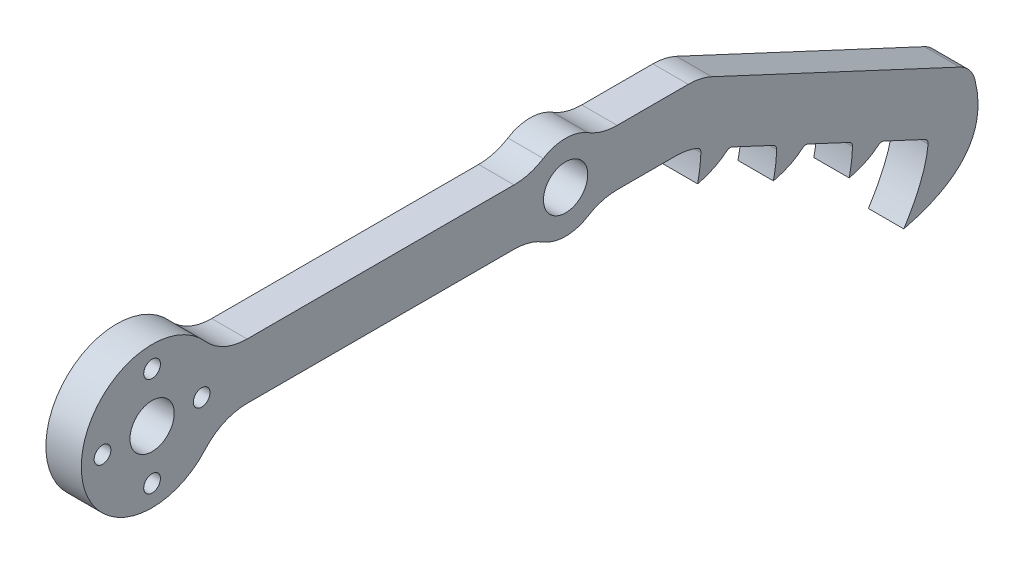
from build123d import *

# Parameters (mm, degrees)
BOSS_EXTRUDE1_DEPTH         = 6.35
F_5_16_0_3125_DOWEL_HOLE1_D = 7.9375
FILLET1_R                   = 10
FILLET2_R                   = 10
FILLET4_R                   = 5
FILLET5_R                   = 1
FILLET6_R                   = 10
F_3_0MM_DOWEL_HOLE1_D       = 3
CIRPATTERN1_COUNT           = 4


with BuildPart() as part:
    # Sketch1 → Boss-Extrude1 (new body)
    with BuildSketch(Plane(origin=(0, 0, 0), x_dir=(0, 0, -1), z_dir=(1, 0, 0))):
        with BuildLine():
            Line((-28.374994089, 49.86223243), (28.354545267, 49.86223243))
            ThreePointArc((28.354545267, 49.86223243), (34.104710482, 47.24223243), (39.854875697, 49.86223243))
            Line((39.854875697, 49.86223243), (56.104710487, 49.86223243))
            Line((56.104710487, 49.86223243), (58.379362515, 48.80154477))
            add(Edge.make_bspline(
                [(58.379362515, 48.80154477), (58.386228757, 46.363071997), (57.773854653, 43.567008128)],
                knots=[0, 0, 0, 1, 1, 1], degree=2))
            add(Edge.make_bspline(
                [(63.433148606, 46.444925613), (61.354068213, 44.407555536), (57.773854653, 43.567008128)],
                knots=[0.61808465, 0.61808465, 0.61808465, 1, 1, 1], degree=2))
            Line((63.433148606, 46.444925613), (71.973979321, 42.462270844))
            add(Edge.make_bspline(
                [(71.973979321, 42.462270844), (71.980845562, 40.023798071), (71.368471459, 37.227734202)],
                knots=[0, 0, 0, 1, 1, 1], degree=2))
            add(Edge.make_bspline(
                [(77.027765412, 40.105651687), (74.948685018, 38.06828161), (71.368471459, 37.227734202)],
                knots=[0.61808465, 0.61808465, 0.61808465, 1, 1, 1], degree=2))
            Line((77.027765412, 40.105651687), (85.568596126, 36.122996918))
            add(Edge.make_bspline(
                [(85.568596126, 36.122996918), (85.575462368, 33.684524145), (84.963088264, 30.888460276)],
                knots=[0, 0, 0, 1, 1, 1], degree=2))
            add(Edge.make_bspline(
                [(90.622382217, 33.766377761), (88.543301824, 31.729007684), (84.963088264, 30.888460276)],
                knots=[0.61808465, 0.61808465, 0.61808465, 1, 1, 1], degree=2))
            Line((90.622382217, 33.766377761), (99.163212932, 29.783722992))
            add(Edge.make_bspline(
                [(99.163212932, 29.783722992), (98.939072146, 24.65005498), (94.755179462, 18.075155142)],
                knots=[0, 0, 0, 1, 1, 1], degree=2))
            add(Edge.make_bspline(
                [(94.755179462, 18.075155142), (112.208752339, 22.33534385), (106.773416656, 37.268805905)],
                knots=[0.444949083, 0.444949083, 0.444949083, 1.444949083, 1.444949083, 1.444949083], degree=2))
            Line((106.773416656, 37.268805905), (58.321657114, 59.86223243))
            Line((58.321657114, 59.86223243), (39.854875697, 59.86223243))
            ThreePointArc((39.854875697, 59.86223243), (34.104710482, 62.48223243), (28.354545266, 59.86223243))
            Line((28.354545266, 59.86223243), (-28.374994089, 59.86223243))
            ThreePointArc((-28.374994089, 59.86223243), (-52.749324906, 54.86223243), (-28.374994089, 49.86223243))
        make_face()
    extrude(amount=BOSS_EXTRUDE1_DEPTH)

    # 5/16 (0.3125) Dowel Hole1 (through all)
    with Locations(Plane(origin=(6.35, 0, 0), x_dir=(0, 0, -1), z_dir=(1, 0, 0))):
        with Locations((-40.049324906, 54.86223243), (34.104710482, 54.86223243)):
            Hole(F_5_16_0_3125_DOWEL_HOLE1_D / 2)

    # Fillet1
    fillet1_edges = [part.edges().sort_by_distance(p)[0] for p in [
        (3.175, 59.86223243, 28.374994089),
        (3.175, 49.86223243, 28.374994089),
    ]]
    fillet(fillet1_edges, radius=FILLET1_R)

    # Fillet2
    fillet2_edges = [part.edges().sort_by_distance(p)[0] for p in [
        (3.175, 49.86223243, -56.104710487),
        (3.175, 59.86223243, -58.321657114),
    ]]
    fillet(fillet2_edges, radius=FILLET2_R)

    # Fillet4
    fillet4_edges = [part.edges().sort_by_distance(p)[0] for p in [
        (3.175, 37.268805905, -106.773416656),
    ]]
    fillet(fillet4_edges, radius=FILLET4_R)

    # Fillet5
    fillet5_edges = [part.edges().sort_by_distance(p)[0] for p in [
        (3.175, 33.766377761, -90.622382217),
        (3.175, 40.105651687, -77.027765412),
        (3.175, 46.444925613, -63.433148606),
        (3.175, 48.80154477, -58.379362515),
        (3.175, 42.462270844, -71.973979321),
        (3.175, 36.122996918, -85.568596126),
        (3.175, 29.783722992, -99.163212932),
    ]]
    fillet(fillet5_edges, radius=FILLET5_R)

    # Fillet6
    fillet6_edges = [part.edges().sort_by_distance(p)[0] for p in [
        (3.175, 49.86223243, -28.354545267),
        (3.175, 49.86223243, -39.854875697),
        (3.175, 59.86223243, -28.354545266),
        (3.175, 59.86223243, -39.854875697),
    ]]
    fillet(fillet6_edges, radius=FILLET6_R)

    # Ø3.0mm Dowel Hole1 (through all)
    with Locations(Plane(origin=(6.35, 0, 0), x_dir=(0, 0, -1), z_dir=(1, 0, 0))):
        with Locations((-40.049324906, 63.75223243), (-40.049324906, 54.86223243)):
            f_3_0mm_dowel_hole1 = Hole(F_3_0MM_DOWEL_HOLE1_D / 2)

    # CirPattern1: Ø3.0mm Dowel Hole1 ×4 about axis
    cirpattern1_axis = Axis((6.35, 54.86223243, 40.049324906), (1, 0, 0))
    for i in range(1, CIRPATTERN1_COUNT):
        add(f_3_0mm_dowel_hole1.rotate(cirpattern1_axis, i * 360 / CIRPATTERN1_COUNT), mode=Mode.SUBTRACT)


solid = part.part
